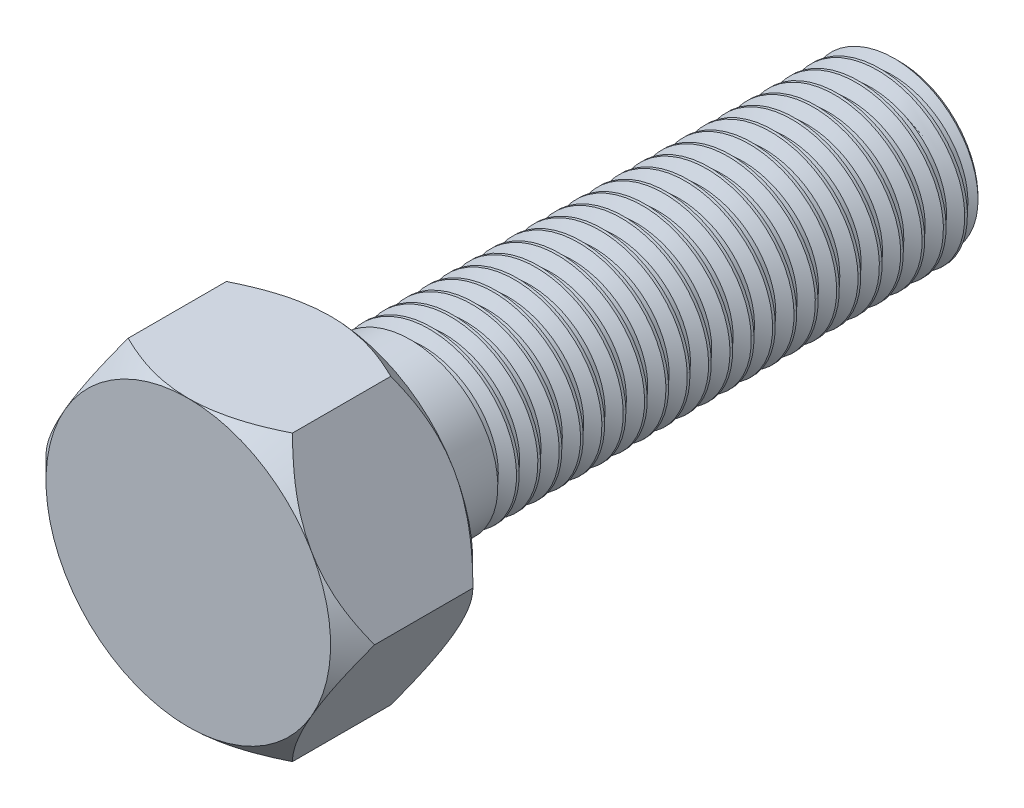
from build123d import *

# Parameters (mm, degrees)
BOSS_EXTRUDE1_DEPTH     = 5
SKETCH2_OUTSIDE_W       = 49.524
SKETCH2_OUTSIDE_H       = 46.43
SKETCH2_OUTSIDE_R       = 10
CUT_EXTRUDE1_DEPTH      = 9
CUT_EXTRUDE1_DRAFT      = -45
MIRROR1_COPY_1_SKETCH_W = 49.524
MIRROR1_COPY_1_SKETCH_H = 46.43
MIRROR1_COPY_1_SKETCH_R = 10
MIRROR1_COPY_1_DEPTH    = 9
MIRROR1_COPY_1_DRAFT    = -45
SKETCH3_R               = 6
BOSS_EXTRUDE2_DEPTH     = 40
CHAMFER1_SIZE           = 0.5
THREAD1_PITCH           = 1.5
CUT_EXTRUDE2_DEPTH      = 48.521924859


with BuildPart() as part:
    # Sketch1 → Boss-Extrude1 (new, symmetric)
    with BuildSketch(Plane.XY):
        Polygon((5.773502692, -10), (11.547005384, 0), (5.773502692, 10), (-5.773502692, 10), (-11.547005384, 0), (-5.773502692, -10), align=None)
    extrude(amount=BOSS_EXTRUDE1_DEPTH, both=True)


with BuildPart() as cut_extrude1_tool:
    # Sketch2 outside → Cut-Extrude1 (with draft: the straight prism first)
    with BuildSketch(Plane.XY.offset(5)):
        Rectangle(SKETCH2_OUTSIDE_W, SKETCH2_OUTSIDE_H)
        Circle(SKETCH2_OUTSIDE_R, mode=Mode.SUBTRACT)
    extrude(amount=-CUT_EXTRUDE1_DEPTH)
    # Cut-Extrude1: the draft: its side faces are tilted about the plane it starts from
    cut_extrude1_sides = [cut_extrude1_tool.faces().sort_by_distance(p)[0] for p in [
        (0, -23.215, 0.5),
        (24.762, 0, 0.5),
        (0, 23.215, 0.5),
        (-24.762, 0, 0.5),
        (-10, 0, 0.5),
    ]]
    draft(cut_extrude1_sides, Plane.XY.offset(5), CUT_EXTRUDE1_DRAFT)


with BuildPart() as part_1:
    add(part.part)

    # Cut-Extrude1: cut by cut_extrude1_tool
    add(cut_extrude1_tool.part, mode=Mode.SUBTRACT)


with BuildPart() as mirror1_copy_1_tool:
    # Mirror1 copy 1 sketch → Mirror1 copy 1 (with draft: the straight prism first)
    with BuildSketch(Plane(origin=(0, 0, -5), x_dir=(1, 0, 0), z_dir=(0, 0, -1))):
        Rectangle(MIRROR1_COPY_1_SKETCH_W, MIRROR1_COPY_1_SKETCH_H)
        Circle(MIRROR1_COPY_1_SKETCH_R, mode=Mode.SUBTRACT)
    extrude(amount=-MIRROR1_COPY_1_DEPTH)
    # Mirror1 copy 1: the draft: its side faces are tilted about the plane it starts from
    mirror1_copy_1_sides = [mirror1_copy_1_tool.faces().sort_by_distance(p)[0] for p in [
        (0, -23.215, -0.5),
        (24.762, 0, -0.5),
        (0, 23.215, -0.5),
        (-24.762, 0, -0.5),
        (-10, 0, -0.5),
    ]]
    draft(mirror1_copy_1_sides, Plane(origin=(0, 0, -5), x_dir=(1, 0, 0), z_dir=(0, 0, -1)), MIRROR1_COPY_1_DRAFT)


with BuildPart() as part_2:
    add(part_1.part)

    # Mirror1 copy 1: cut by mirror1_copy_1_tool
    add(mirror1_copy_1_tool.part, mode=Mode.SUBTRACT)

    # Sketch3 → Boss-Extrude2 (add)
    with BuildSketch(Plane(origin=(0, 0, -5), x_dir=(-1, 0, 0), z_dir=(0, 0, -1))):
        with Locations(Location((0, 0, 0), (0, 0, 180))):
            Circle(SKETCH3_R)
    extrude(amount=BOSS_EXTRUDE2_DEPTH)

    # Chamfer1
    chamfer1_edges = [part_2.edges().sort_by_distance(p)[0] for p in [
        (-6, 0, -45),
    ]]
    chamfer(chamfer1_edges, length=CHAMFER1_SIZE)

    # Thread1: arcs per turn and ends read off the stored shape
    # Thread1: the profile of Thread Profile2 profile screwed along a right-hand helix through 24.333333 turns, 8 arcs to a turn; built about Z, then put on its axis
    thread1_z = Axis((0, 0, 0), (0, 0, 1))
    thread1_corners = [(6.0003, 0, -0.000173205), (6.0003, 0, 1.312673201), (5.188101188, 0, 0.843749998), (5.188101188, 0, 0.468749998)]
    with BuildLine(mode=Mode.PRIVATE) as thread1_profile:
        Line(thread1_corners[0], thread1_corners[1])
        Line(thread1_corners[1], thread1_corners[2])
        Line(thread1_corners[2], thread1_corners[3])
        Line(thread1_corners[3], thread1_corners[0])
    thread1_cap = Face(thread1_profile.wire())
    thread1_turn_angles = [0, 22.5, 45, 67.5, 90, 112.5, 135, 157.5, 180, 202.5, 225, 247.5, 270, 292.5, 315, 337.5, 360]
    thread1_turn_weights = [1, 0.9238795325112867, 1, 0.9238795325112867, 1, 0.9238795325112867, 1, 0.9238795325112867, 1, 0.9238795325112867, 1, 0.9238795325112867, 1, 0.9238795325112867, 1, 0.9238795325112867, 1]
    thread1_turn_rails = [Edge.make_bspline([Vector(p[0], p[1], 0).rotate(thread1_z, thread1_turn_angles[k]) / thread1_turn_weights[k] + Vector(0, 0, p[2] + THREAD1_PITCH * thread1_turn_angles[k] / 360) for k in range(17)], [0, 0, 0, 1, 1, 2, 2, 3, 3, 4, 4, 5, 5, 6, 6, 7, 7, 8, 8, 8], 2, thread1_turn_weights) for p in thread1_corners]
    thread1_turn_sides = [Face.make_surface_from_curves(thread1_turn_rails[p[0]], thread1_turn_rails[p[1]]) for p in [(0, 1), (1, 2), (2, 3), (3, 0)]]
    thread1_last_angles = [8640, 8662.5, 8685, 8707.5, 8730, 8745, 8760]
    thread1_last_weights = [1, 0.9238795325112867, 1, 0.9238795325112867, 1, 0.9659258262890683, 1]
    thread1_last_rails = [Edge.make_bspline([Vector(p[0], p[1], 0).rotate(thread1_z, thread1_last_angles[k]) / thread1_last_weights[k] + Vector(0, 0, p[2] + THREAD1_PITCH * thread1_last_angles[k] / 360) for k in range(7)], [0, 0, 0, 1, 1, 2, 2, 3, 3, 3], 2, thread1_last_weights) for p in thread1_corners]
    thread1_last_sides = [Face.make_surface_from_curves(thread1_last_rails[p[0]], thread1_last_rails[p[1]]) for p in [(0, 1), (1, 2), (2, 3), (3, 0)]]
    thread1 = Plane(origin=(0, 0, -10), x_dir=(-1, 0, 0), z_dir=(0, 0, -1)) * Solid(Shell([*[p.moved(Location((0, 0, THREAD1_PITCH * i))) for i in range(24) for p in thread1_turn_sides], *thread1_last_sides, thread1_cap, thread1_cap.rotate(thread1_z, 8760).moved(Location((0, 0, THREAD1_PITCH * 8760 / 360)))]))
    add(thread1, mode=Mode.SUBTRACT)

    # Sketch12 → Cut-Extrude2 (cut, through all)
    with BuildSketch(Plane(origin=(0, 0, 0), x_dir=(1, 0, 0), z_dir=(0, 1, 0))):
        Polygon((-6, 10), (-5.188101188, 10.468749998), (-5.188101188, 10.843749998), (-6, 11.312499996), align=None)
    extrude(amount=-CUT_EXTRUDE2_DEPTH, mode=Mode.SUBTRACT)


solid = part_2.part
